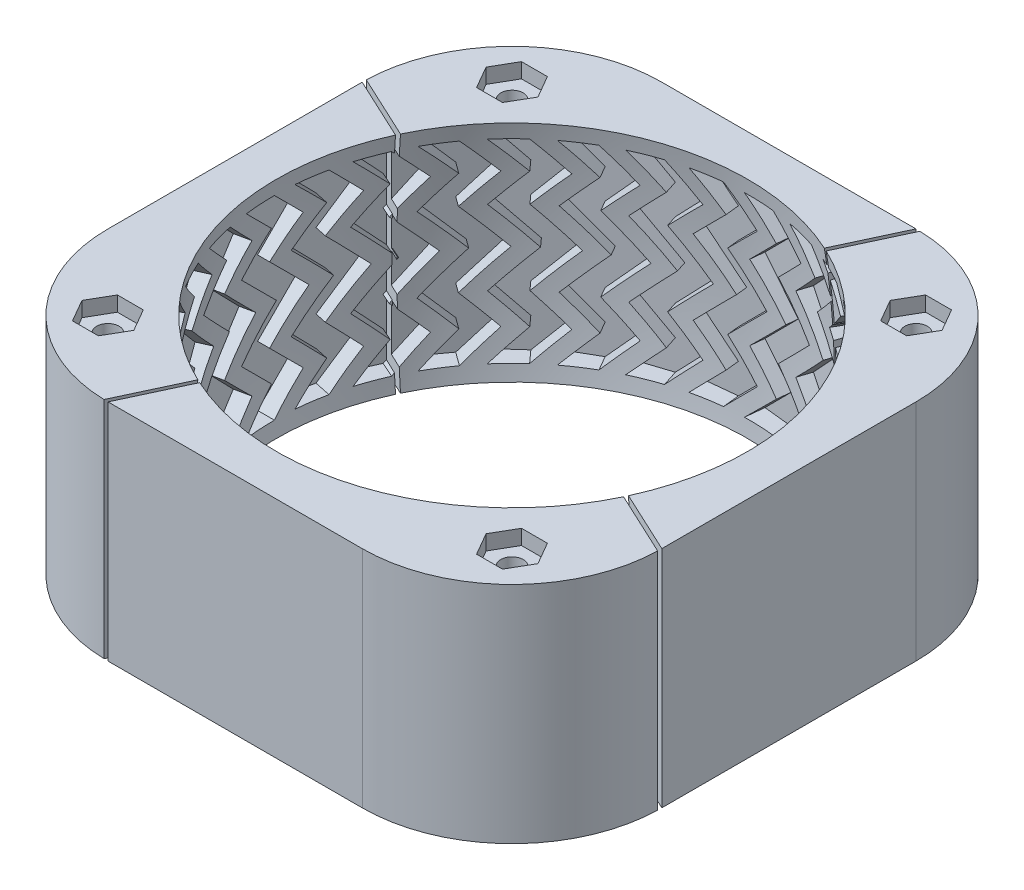
from build123d import *

# Parameters (mm, degrees)
SKETCH_2_W               = 74
SKETCH_2_H               = 74
EXTRUDE_1_DEPTH          = 30
FILLET_1_R               = 20
CUT_EXTRUDE_3_DEPTH      = 3
PATTERN_CIRCULAR_1_COUNT = 30
SKETCH_17_R              = 1.5
CUT_EXTRUDE_12_DEPTH     = 61.31583545
CUT_EXTRUDE_13_DEPTH     = 2
CUT_EXTRUDE_15_DEPTH     = 2
CUT_EXTRUDE_16_DEPTH     = 61.31583545


with BuildPart() as part:
    # Эскиз2 → Бобышка-Вытянуть1 (new body)
    with BuildSketch(Plane(origin=(0, 0, 0), x_dir=(1, 0, 0), z_dir=(0, 1, 0))):
        Rectangle(SKETCH_2_W, SKETCH_2_H)
    extrude(amount=EXTRUDE_1_DEPTH)

    # Эскиз3 → Вырез-Повернуть1 (revolve, cut)
    with BuildSketch(Plane(origin=(0, 0, 0), x_dir=(0, 0, -1), z_dir=(1, 0, 0))):
        with BuildLine():
            Line((0, 30), (-31.5, 30))
            ThreePointArc((-31.5, 30), (-32.5, 15), (-31.5, 0))
            Line((-31.5, 0), (0, 0))
            Line((0, 0), (0, 30))
        make_face()
    revolve(axis=Axis((0, 41.352219932, 0), (0, -1, 0)), mode=Mode.SUBTRACT)

    # Скругление1
    fillet_1_edges = [part.edges().sort_by_distance(p)[0] for p in [
        (-37, 15, 37),
        (-37, 15, -37),
        (37, 15, -37),
        (37, 15, 37),
    ]]
    fillet(fillet_1_edges, radius=FILLET_1_R)

    # Эскиз7 → Вырез-Вытянуть3 (cut)
    with BuildSketch(Plane(origin=(31, 0, 0), x_dir=(0, 0, -1), z_dir=(1, 0, 0))):
        Polygon((4, 10), (-1, 15), (4, 20), (0, 24), (4, 28), (0, 28), (-4, 24), (0, 20), (-5, 15), (0, 10), (-4, 6), (0, 2), (4, 2), (0, 6), align=None)
    cut_extrude_3 = extrude(amount=CUT_EXTRUDE_3_DEPTH, mode=Mode.SUBTRACT)

    # Круговой массив1: Вырез-Вытянуть3 ×30 about axis
    pattern_circular_1_axis = Axis((0, 30, 0), (0, 1, 0))
    for i in range(1, PATTERN_CIRCULAR_1_COUNT):
        add(cut_extrude_3.rotate(pattern_circular_1_axis, i * 360 / PATTERN_CIRCULAR_1_COUNT), mode=Mode.SUBTRACT)

    # Эскиз17 → Вырез-Вытянуть12 (cut, through all)
    with BuildSketch(Plane(origin=(0, 0, 0), x_dir=(1, 0, 0), z_dir=(0, 1, 0))):
        with Locations((-27, 27)):
            Circle(SKETCH_17_R)
        with Locations((27, 27)):
            Circle(SKETCH_17_R)
        with Locations((27, -27)):
            Circle(SKETCH_17_R)
        with Locations((-27, -27)):
            Circle(SKETCH_17_R)
    extrude(amount=CUT_EXTRUDE_12_DEPTH, mode=Mode.SUBTRACT)

    # Эскиз18 → Вырез-Вытянуть13 (cut)
    with BuildSketch(Plane(origin=(0, 30, 0), x_dir=(1, 0, 0), z_dir=(0, 1, 0))):
        Polygon((-28.732050808, 30), (-30.464101615, 27), (-28.732050808, 24), (-25.267949192, 24), (-23.535898385, 27), (-25.267949192, 30), align=None)
        Polygon((25.267949192, 30), (23.535898385, 27), (25.267949192, 24), (28.732050808, 24), (30.464101615, 27), (28.732050808, 30), align=None)
        Polygon((25.267949192, -24), (23.535898385, -27), (25.267949192, -30), (28.732050808, -30), (30.464101615, -27), (28.732050808, -24), align=None)
        Polygon((-28.732050808, -24), (-30.464101615, -27), (-28.732050808, -30), (-25.267949192, -30), (-23.535898385, -27), (-25.267949192, -24), align=None)
    extrude(amount=-CUT_EXTRUDE_13_DEPTH, mode=Mode.SUBTRACT)

    # Эскиз19 → Вырез-Вытянуть15 (cut)
    with BuildSketch(Plane(origin=(0, 0, 0), x_dir=(1, 0, 0), z_dir=(0, 1, 0))):
        Polygon((-28.732050808, -30), (-25.267949192, -30), (-23.535898385, -27), (-25.267949192, -24), (-28.732050808, -24), (-30.464101615, -27), align=None)
        Polygon((25.267949192, -30), (28.732050808, -30), (30.464101615, -27), (28.732050808, -24), (25.267949192, -24), (23.535898385, -27), align=None)
        Polygon((25.267949192, 24), (28.732050808, 24), (30.464101615, 27), (28.732050808, 30), (25.267949192, 30), (23.535898385, 27), align=None)
        Polygon((-28.732050808, 24), (-25.267949192, 24), (-23.535898385, 27), (-25.267949192, 30), (-28.732050808, 30), (-30.464101615, 27), align=None)
    extrude(amount=CUT_EXTRUDE_15_DEPTH, mode=Mode.SUBTRACT)

    # Эскиз20 → Вырез-Вытянуть16 (cut, through all)
    with BuildSketch(Plane(origin=(0, 0, 0), x_dir=(1, 0, 0), z_dir=(0, 1, 0))):
        Polygon((-17.526001847, -36.993081855), (-17.072847954, -37.204390986), (0.120922381, -0.332231512), (-0.332231512, -0.120922381), align=None)
        Polygon((0.332231512, 0.120922381), (0.120922381, -0.332231512), (36.993081855, -17.526001847), (37.204390986, -17.072847954), align=None)
        Polygon((-37.204390986, 17.072847954), (-0.332231512, -0.120922381), (-0.120922381, 0.332231512), (-36.993081855, 17.526001847), align=None)
        Polygon((-0.120922381, 0.332231512), (0.332231512, 0.120922381), (17.526001847, 36.993081855), (17.072847954, 37.204390986), align=None)
    extrude(amount=CUT_EXTRUDE_16_DEPTH, mode=Mode.SUBTRACT)


with BuildPart() as cut_extrude_16_piece_1:
    # of the separate pieces the step leaves, piece 1, a body of its own (cut_extrude_16_pieces)
    add(part.part.solids().sort_by_distance((17, 0, 37))[0])


with BuildPart() as cut_extrude_16_piece_2:
    # of the separate pieces the step leaves, piece 2, a body of its own (cut_extrude_16_pieces)
    add(part.part.solids().sort_by_distance((-28.442141597, 0, -13.538632921))[0])


with BuildPart() as cut_extrude_16_piece_3:
    # of the separate pieces the step leaves, piece 3, a body of its own (cut_extrude_16_pieces)
    add(part.part.solids().sort_by_distance((-13.538632921, 0, 28.442141597))[0])


with BuildPart() as cut_extrude_16_piece_4:
    # of the separate pieces the step leaves, piece 4, a body of its own (cut_extrude_16_pieces)
    add(part.part.solids().sort_by_distance((37, 0, -17))[0])


solid = Compound([cut_extrude_16_piece_1.part, cut_extrude_16_piece_2.part, cut_extrude_16_piece_3.part, cut_extrude_16_piece_4.part])
